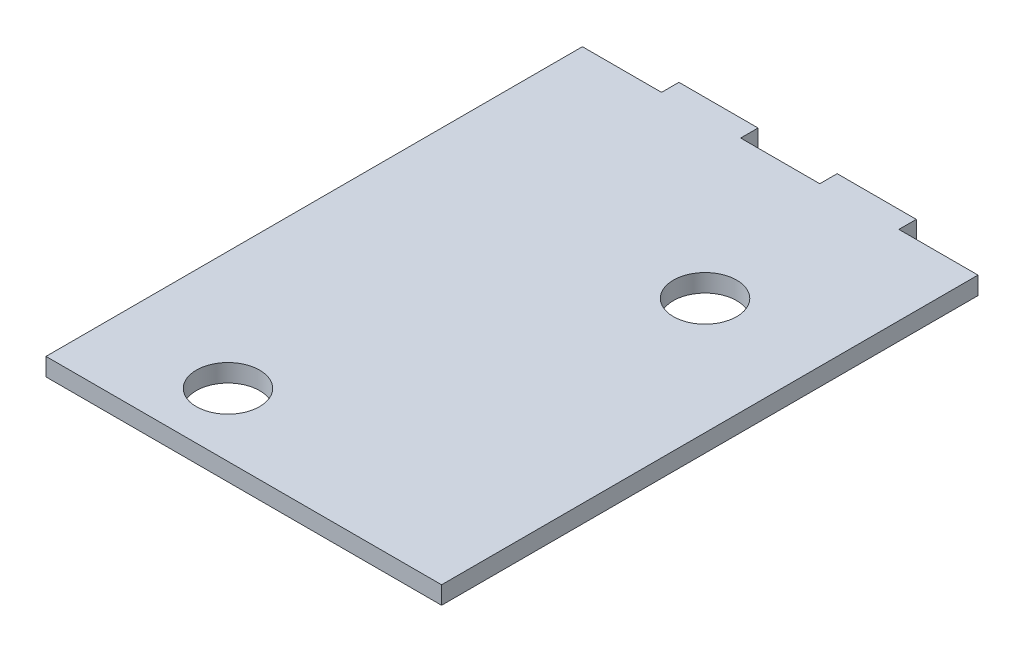
from build123d import *

# Parameters (mm, degrees)
SKETCH2_W           = 220
SKETCH2_H           = 140
BOSS_EXTRUDE1_DEPTH = 4.5
SKETCH3_R           = 8
CUT_EXTRUDE1_DEPTH  = 131.461680198
SKETCH4_W           = 20
SKETCH4_H           = 4.4
TEETH_CUT_DEPTH     = 131.461680198
SKETCH5_W           = 40
SKETCH5_H           = 140.1
SKETCH5_W_2         = 80
TRIM_CUT_DEPTH      = 131.461680198


with BuildPart() as part:
    # Sketch2 → Boss-Extrude1 (new body)
    with BuildSketch(Plane(origin=(0, 0, 0), x_dir=(1, 0, 0), z_dir=(0, 1, 0))):
        Rectangle(SKETCH2_W, SKETCH2_H)
    extrude(amount=BOSS_EXTRUDE1_DEPTH)

    # Sketch3 → Cut-Extrude1 (cut, through all)
    with BuildSketch(Plane(origin=(0, 4.5, 0), x_dir=(1, 0, 0), z_dir=(0, 1, 0))):
        with Locations((0, -54)):
            Circle(SKETCH3_R)
        with Locations((40.6, 26)):
            Circle(SKETCH3_R)
    extrude(amount=-CUT_EXTRUDE1_DEPTH, mode=Mode.SUBTRACT)

    # Sketch4 → Teeth cut (cut, through all)
    with BuildSketch(Plane.XZ):
        with Locations((100, -67.8)):
            Rectangle(SKETCH4_W, SKETCH4_H)
        with Locations((60, -67.8)):
            Rectangle(SKETCH4_W, SKETCH4_H)
        with Locations((20, -67.8)):
            Rectangle(SKETCH4_W, SKETCH4_H)
        with Locations((-20, -67.8)):
            Rectangle(SKETCH4_W, SKETCH4_H)
        with Locations((-60, -67.8)):
            Rectangle(SKETCH4_W, SKETCH4_H)
        with Locations((-100, -67.8)):
            Rectangle(SKETCH4_W, SKETCH4_H)
    extrude(amount=-TEETH_CUT_DEPTH, mode=Mode.SUBTRACT)

    # Sketch5 → Trim cut (cut, through all)
    with BuildSketch(Plane.XZ):
        with Locations((90, -0.05)):
            Rectangle(SKETCH5_W, SKETCH5_H)
        with Locations((-70, -0.05)):
            Rectangle(SKETCH5_W_2, SKETCH5_H)
    extrude(amount=-TRIM_CUT_DEPTH, mode=Mode.SUBTRACT)


solid = part.part
